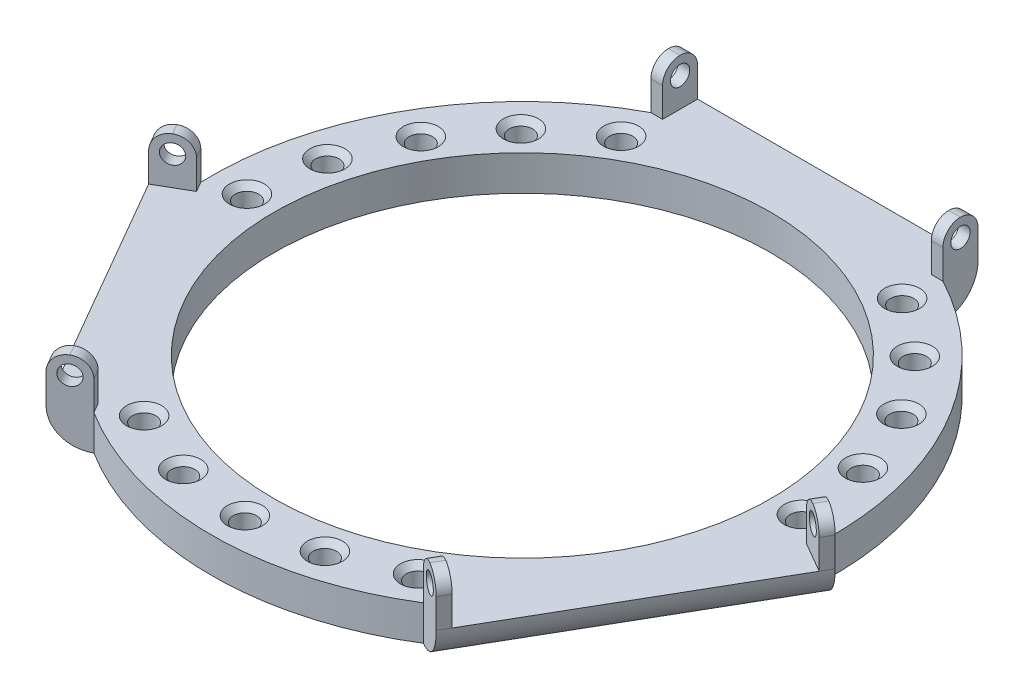
from build123d import *

# Parameters (mm, degrees)
SKETCH1_W                = 2
SKETCH1_H                = 6
BOSS_EXTRUDE1_DEPTH      = 8
BOSS_EXTRUDE1_2_DEPTH    = 8
BOSS_EXTRUDE2_DEPTH      = 6
FILLET2_R                = 3
SKETCH3_R                = 1.65
CUT_EXTRUDE1_DEPTH       = 90.043007931
FILLET3_R                = 6
CIRPATTERN2_COUNT        = 3
FILLET2_OF_CIRPATTERN2_R = 3
FILLET3_OF_CIRPATTERN2_R = 6
SKETCH4_R                = 2
CUT_EXTRUDE2_DEPTH       = 80.425963387
CHAMFER1_SIZE            = 1


with BuildPart() as part:
    # Sketch1 → Boss-Extrude1 (new body)
    with BuildSketch(Plane(origin=(0, 0, 0), x_dir=(1, 0, 0), z_dir=(0, 1, 0))):
        with Locations((-24, 50)):
            Rectangle(SKETCH1_W, SKETCH1_H)
    boss_extrude1 = extrude(amount=BOSS_EXTRUDE1_DEPTH)



with BuildPart() as body_2:
    # Sketch1 → Boss-Extrude1 2 (new body)
    with BuildSketch(Plane(origin=(0, 0, 0), x_dir=(1, 0, 0), z_dir=(0, 1, 0))):
        with Locations((24, 50)):
            Rectangle(SKETCH1_W, SKETCH1_H)
    boss_extrude1_2 = extrude(amount=BOSS_EXTRUDE1_2_DEPTH)


with BuildPart() as part_1:
    add(part.part)

    add(body_2.part)  # Boss-Extrude2 merges body 2
    # Sketch2 → Boss-Extrude2 (add)
    with BuildSketch(Plane(origin=(0, 0, 0), x_dir=(1, 0, 0), z_dir=(0, 1, 0))):
        with BuildLine():
            Line((25, 53), (-25, 53))
            Line((-25, 53), (-25, 47))
            ThreePointArc((-25, 47), (-36.983431799, 38.291327639), (-46.103145229, 26.617663308))
            Line((-46.103145229, 26.617663308), (-36.806079661, 21.25))
            ThreePointArc((-36.806079661, 21.25), (0, 42.5), (36.806079661, 21.25))
            Line((36.806079661, 21.25), (46.103145229, 26.617663308))
            ThreePointArc((46.103145229, 26.617663308), (36.983431799, 38.291327639), (25, 47))
            Line((25, 47), (25, 53))
        make_face()
    boss_extrude2 = extrude(amount=-BOSS_EXTRUDE2_DEPTH)

    # Fillet2
    fillet2_edges = [part_1.edges().sort_by_distance(p)[0] for p in [
        (24, 8, -47),
        (24, 8, -53),
        (-24, 8, -47),
        (-24, 8, -53),
    ]]
    fillet(fillet2_edges, radius=FILLET2_R - 0.0001)  # a hair under: the kernel refuses the full size

    # Sketch3 → Cut-Extrude1 (cut, through all)
    with BuildSketch(Plane(origin=(25, 0, 0), x_dir=(0, 0, -1), z_dir=(1, 0, 0))):
        with Locations((50, 5)):
            Circle(SKETCH3_R)
    cut_extrude1 = extrude(amount=-CUT_EXTRUDE1_DEPTH, mode=Mode.SUBTRACT)

    # Fillet3
    fillet3_edges = [part_1.edges().sort_by_distance(p)[0] for p in [
        (0, -6, -53),
    ]]
    fillet(fillet3_edges, radius=FILLET3_R - 0.0001)  # a hair under: the kernel refuses the full size

    # CirPattern2: Boss-Extrude1, Boss-Extrude1 2, Boss-Extrude2, Cut-Extrude1 ×3 about axis
    cirpattern2_axis = Axis((0, 0, 0), (0, 1, 0))
    add([boss_extrude1.rotate(cirpattern2_axis, i * 360 / CIRPATTERN2_COUNT) for i in range(1, CIRPATTERN2_COUNT)])
    add([boss_extrude1_2.rotate(cirpattern2_axis, i * 360 / CIRPATTERN2_COUNT) for i in range(1, CIRPATTERN2_COUNT)])
    add([boss_extrude2.rotate(cirpattern2_axis, i * 360 / CIRPATTERN2_COUNT) for i in range(1, CIRPATTERN2_COUNT)])
    add([cut_extrude1.rotate(cirpattern2_axis, i * 360 / CIRPATTERN2_COUNT) for i in range(1, CIRPATTERN2_COUNT)], mode=Mode.SUBTRACT)

    # Fillet2 of CirPattern2
    fillet2_of_cirpattern2_edges = [part_1.edges().sort_by_distance(p)[0] for p in [
        (-52.703193978, 8, 2.715390309),
        (-57.899346401, 8, 5.715390309),
        (-28.703193978, 8, 44.284609691),
        (-33.899346401, 8, 47.284609691),
        (28.703193978, 8, 44.284609691),
        (33.899346401, 8, 47.284609691),
        (52.703193978, 8, 2.715390309),
        (57.899346401, 8, 5.715390309),
    ]]
    fillet(fillet2_of_cirpattern2_edges, radius=FILLET2_OF_CIRPATTERN2_R - 0.0001)  # a hair under: the kernel refuses the full size

    # Fillet3 of CirPattern2
    fillet3_of_cirpattern2_edges = [part_1.edges().sort_by_distance(p)[0] for p in [
        (-45.899346401, -6, 26.5),
        (45.899346401, -6, 26.5),
    ]]
    fillet(fillet3_of_cirpattern2_edges, radius=FILLET3_OF_CIRPATTERN2_R - 0.0001)  # a hair under: the kernel refuses the full size

    # Sketch4 → Cut-Extrude2 (cut, through all)
    with BuildSketch(Plane(origin=(0, 0, 0), x_dir=(1, 0, 0), z_dir=(0, 1, 0))):
        with Locations(Location((-41.13620668, 23.75, 0), (0, 0, 270))):
            Circle(SKETCH4_R)
        with Locations(Location((-24.052579046, 40.960022476, 0), (0, 0, 270))):
            Circle(SKETCH4_R)
        with Locations(Location((-47.498709527, 0.350133242, 0), (0, 0, 270))):
            Circle(SKETCH4_R)
        with Locations(Location((-33.711135616, 33.463552344, 0), (0, 0, 270))):
            Circle(SKETCH4_R)
        with Locations(Location((-45.835854239, 12.462923661, 0), (0, 0, 270))):
            Circle(SKETCH4_R)
        with Locations(Location((47.498709527, 0.350133242, 0), (0, 0, 270))):
            Circle(SKETCH4_R)
        with Locations(Location((45.835854239, 12.462923661, 0), (0, 0, 270))):
            Circle(SKETCH4_R)
        with Locations(Location((41.13620668, 23.75, 0), (0, 0, 270))):
            Circle(SKETCH4_R)
        with Locations(Location((33.711135616, 33.463552344, 0), (0, 0, 270))):
            Circle(SKETCH4_R)
        with Locations(Location((24.052579046, 40.960022476, 0), (0, 0, 270))):
            Circle(SKETCH4_R)
        with Locations(Location((-23.446130481, -41.310155718, 0), (0, 0, 270))):
            Circle(SKETCH4_R)
        with Locations(Location((-12.124718623, -45.926476006, 0), (0, 0, 270))):
            Circle(SKETCH4_R)
        with Locations(Location((0, -47.5, 0), (0, 0, 270))):
            Circle(SKETCH4_R)
        with Locations(Location((12.124718623, -45.926476006, 0), (0, 0, 270))):
            Circle(SKETCH4_R)
        with Locations(Location((23.446130481, -41.310155718, 0), (0, 0, 270))):
            Circle(SKETCH4_R)
    extrude(amount=-CUT_EXTRUDE2_DEPTH, mode=Mode.SUBTRACT)

    # Chamfer1
    chamfer1_edges = [part_1.edges().sort_by_distance(p)[0] for p in [
        (-41.13620668, 0, -25.75),
        (-24.052579046, 0, -42.960022476),
        (-47.498709527, 0, -2.350133242),
        (-33.711135616, 0, -35.463552344),
        (-45.835854239, 0, -14.462923661),
        (41.13620668, 0, -25.75),
        (47.498709527, 0, -2.350133242),
        (24.052579046, 0, -42.960022476),
        (45.835854239, 0, -14.462923661),
        (33.711135616, 0, -35.463552344),
        (0, 0, 45.5),
        (-23.446130481, 0, 39.310155718),
        (23.446130481, 0, 39.310155718),
        (-12.124718623, 0, 43.926476006),
        (12.124718623, 0, 43.926476006),
    ]]
    chamfer(chamfer1_edges, length=CHAMFER1_SIZE)


solid = part_1.part
